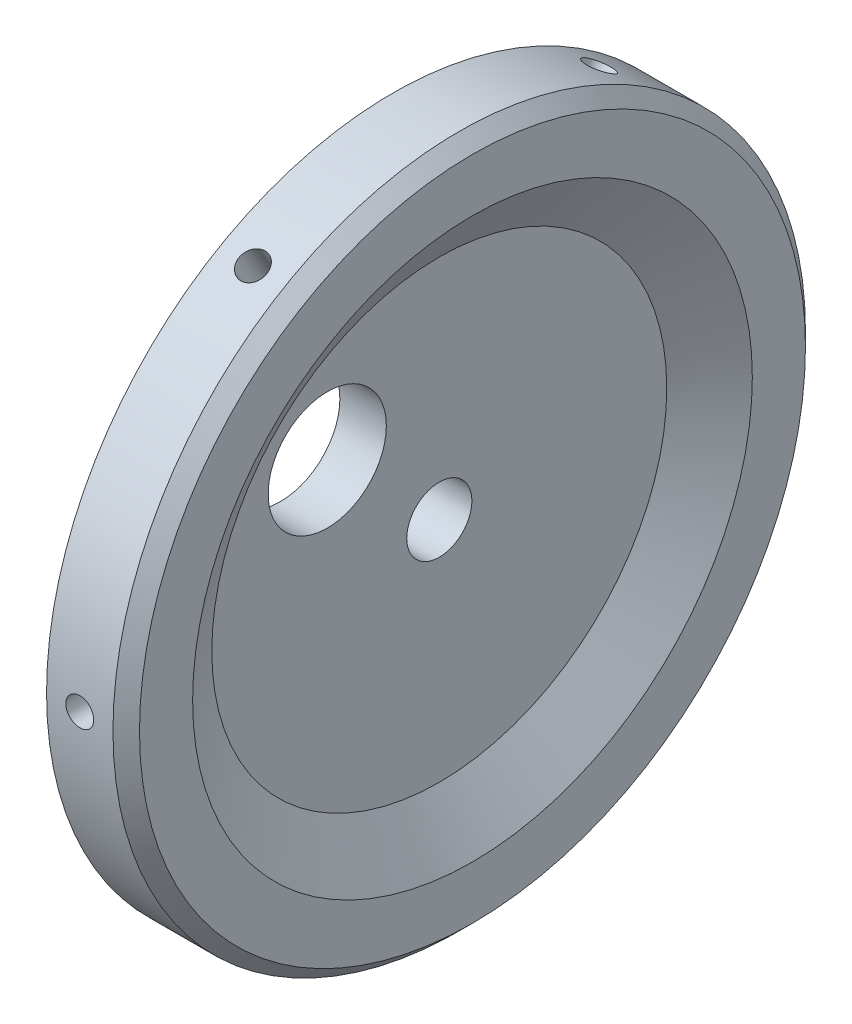
from build123d import *

# Parameters (mm, degrees)
CHAMFER1_SIZE      = 2
SKETCH3_R          = 8.9
CUT_EXTRUDE1_DEPTH = 10
CIRPATTERN1_COUNT  = 6


with BuildPart() as part:
    # Sketch1 → Revolve1 (revolve)
    with BuildSketch(Plane(origin=(0, 0, 0), x_dir=(1, 0, 0), z_dir=(0, 1, 0))):
        Polygon((0, 4.9022), (0, 52.15), (12, 52.15), (12, 42.15), (7, 34.26), (7, 4.9022), align=None)
    revolve(axis=Axis((0, 0, 0), (1, 0, 0)))

    # Chamfer1
    chamfer1_edges = [part.edges().sort_by_distance(p)[0] for p in [
        (12, 0, 52.15),
    ]]
    chamfer(chamfer1_edges, length=CHAMFER1_SIZE)

    # Sketch3 → Cut-Extrude1 (cut)
    with BuildSketch(Plane(origin=(7, 0, 0), x_dir=(0, 0, -1), z_dir=(1, 0, 0))):
        with Locations((-16.875192026, 16.225331227)):
            Circle(SKETCH3_R)
    extrude(amount=-CUT_EXTRUDE1_DEPTH, mode=Mode.SUBTRACT)

    # Sketch6 → M5x0.8 Tapped Hole1 (revolve, cut)
    with BuildSketch(Plane(origin=(5, 0, 52.15), x_dir=(0, -1, 0), z_dir=(1, 0, 0))):
        Polygon((0, 0), (0, 10.2618073), (2.1, 9), (2.1, 0), align=None)
    m5x0_8_tapped_hole1 = revolve(axis=Axis((5, 0, 58.5), (0, 0, -1)), mode=Mode.SUBTRACT)

    # CirPattern1: M5x0.8 Tapped Hole1 ×6 about axis
    cirpattern1_axis = Axis((0, 0, 0), (1, 0, 0))
    for i in range(1, CIRPATTERN1_COUNT):
        add(m5x0_8_tapped_hole1.rotate(cirpattern1_axis, i * 360 / CIRPATTERN1_COUNT), mode=Mode.SUBTRACT)


solid = part.part
